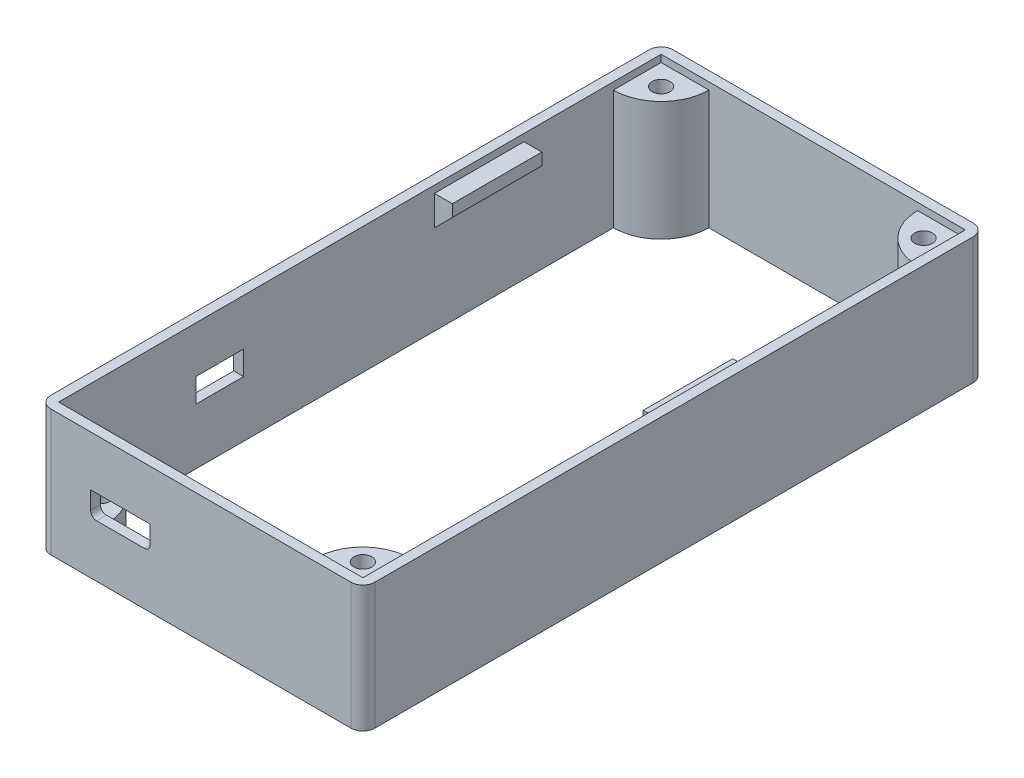
from build123d import *

# Parameters (mm, degrees)
SKICA1_W                 = 54.3
SKICA1_H                 = 104.3
SKICA1_W_2               = 51
SKICA1_H_2               = 101
P_IDAT_VYSUNUT_M1_DEPTH  = 1.2
SKICA2_W                 = 54.3
SKICA2_H                 = 104.3
P_IDAT_VYSUNUT_M2_DEPTH  = 20
SKICA3_R                 = 1.5
ODEBRAT_VYSUNUT_M1_DEPTH = 118.085631057
SKICA5_W                 = 8
SKICA5_H                 = 4
ODEBRAT_VYSUNUT_M2_DEPTH = 2
SKICA6_W                 = 10
SKICA6_H                 = 4
ODEBRAT_VYSUNUT_M3_DEPTH = 5
SKICA9_W                 = 15
SKICA9_H                 = 5
P_IDAT_VYSUNUT_M4_DEPTH  = 2
ZKOSEN_1_SIZE            = 2
SKICA10_W                = 15
SKICA10_H                = 5
P_IDAT_VYSUNUT_M5_DEPTH  = 3
ZKOSEN_2_SIZE            = 3
ZAOBLIT2_R               = 1
ZAOBLIT3_R               = 2
ODEBRAT_VYSUNUT_M5_DEPTH = 12.5
SKICA12_R                = 1.5
ODEBRAT_VYSUNUT_M6_DEPTH = 118.296568577


with BuildPart() as part:
    # Skica1 → Přidat vysunutím1 (new body)
    with BuildSketch(Plane(origin=(0, 0, 0), x_dir=(1, 0, 0), z_dir=(0, 1, 0))):
        with Locations((25.5, 50.5)):
            Rectangle(SKICA1_W, SKICA1_H)
        with Locations((25.5, 50.5)):
            Rectangle(SKICA1_W_2, SKICA1_H_2, mode=Mode.SUBTRACT)
    extrude(amount=P_IDAT_VYSUNUT_M1_DEPTH)

    # Skica2 → Přidat vysunutím2 (add)
    # profile 1 of 5: a face of its own
    with BuildSketch(Plane.XZ):
        with Locations((25.5, -50.5)):
            Rectangle(SKICA2_W, SKICA2_H)
        Polygon((0, -8), (0, 0), (8, 0), (43, 0), (51, 0), (51, -8), (51, -93), (51, -101), (43, -101), (8, -101), (0, -101), (0, -93), align=None, mode=Mode.SUBTRACT)
    # profile 2 of 5: a face of its own
    with BuildSketch(Plane.XZ):
        with BuildLine():
            Line((8, 0), (0, 0))
            Line((0, 0), (0, -8))
            ThreePointArc((0, -8), (5.656854249, -5.656854249), (8, 0))
        make_face()
    # profile 3 of 5: a face of its own
    with BuildSketch(Plane.XZ):
        with BuildLine():
            ThreePointArc((8, -101), (5.656854249, -95.343145751), (0, -93))
            Line((0, -93), (0, -101))
            Line((0, -101), (8, -101))
        make_face()
    # profile 4 of 5: a face of its own
    with BuildSketch(Plane.XZ):
        with BuildLine():
            Line((51, -101), (51, -93))
            ThreePointArc((51, -93), (45.343145751, -95.343145751), (43, -101))
            Line((43, -101), (51, -101))
        make_face()
    # profile 5 of 5: a face of its own
    with BuildSketch(Plane.XZ):
        with BuildLine():
            Line((51, 0), (43, 0))
            ThreePointArc((43, 0), (45.343145751, -5.656854249), (51, -8))
            Line((51, -8), (51, 0))
        make_face()
    extrude(amount=P_IDAT_VYSUNUT_M2_DEPTH)

    # Skica3 → Odebrat vysunutím1 (cut, through all)
    with BuildSketch(Plane(origin=(0, 0, 0), x_dir=(1, 0, 0), z_dir=(0, 1, 0))):
        with Locations(Location((3.5, 97.5, 0), (0, 0, 270))):
            Circle(SKICA3_R)
        with Locations(Location((47.5, 97.5, 0), (0, 0, 270))):
            Circle(SKICA3_R)
        with Locations(Location((47.5, 3.5, 0), (0, 0, 270))):
            Circle(SKICA3_R)
    extrude(amount=-ODEBRAT_VYSUNUT_M1_DEPTH, mode=Mode.SUBTRACT)

    # Skica5 → Odebrat vysunutím2 (cut)
    with BuildSketch(Plane(origin=(0, 0, 0), x_dir=(0, 0, -1), z_dir=(1, 0, 0))):
        with Locations((27, -8.6)):
            Rectangle(SKICA5_W, SKICA5_H)
    extrude(amount=-ODEBRAT_VYSUNUT_M2_DEPTH, mode=Mode.SUBTRACT)

    # Skica6 → Odebrat vysunutím3 (cut, symmetric)
    with BuildSketch(Plane(origin=(0, 0, 0), x_dir=(-1, 0, 0), z_dir=(0, 0, -1))):
        with Locations((-12, -9.2)):
            Rectangle(SKICA6_W, SKICA6_H)
    extrude(amount=ODEBRAT_VYSUNUT_M3_DEPTH, both=True, mode=Mode.SUBTRACT)

    # Skica9 → Přidat vysunutím4 (add)
    with BuildSketch(Plane.ZY.offset(-51)):
        with Locations((-56.5, -2.5)):
            Rectangle(SKICA9_W, SKICA9_H)
    extrude(amount=P_IDAT_VYSUNUT_M4_DEPTH)

    # Zkosení1
    zkosen_1_edges = [part.edges().sort_by_distance(p)[0] for p in [
        (49, -5, -56.5),
    ]]
    chamfer(zkosen_1_edges, length=ZKOSEN_1_SIZE - 0.0001)  # a hair under: the kernel refuses the full size

    # Skica10 → Přidat vysunutím5 (add)
    with BuildSketch(Plane(origin=(0, 0, 0), x_dir=(0, 0, -1), z_dir=(1, 0, 0))):
        with Locations((70.5, -2.5)):
            Rectangle(SKICA10_W, SKICA10_H)
    extrude(amount=P_IDAT_VYSUNUT_M5_DEPTH)

    # Zkosení2
    zkosen_2_edges = [part.edges().sort_by_distance(p)[0] for p in [
        (3, -5, -70.5),
    ]]
    chamfer(zkosen_2_edges, length=ZKOSEN_2_SIZE - 0.0001)  # a hair under: the kernel refuses the full size

    # Zaoblit2
    zaoblit2_edges = [part.edges().sort_by_distance(p)[0] for p in [
        (7, -11.2, -1.111491673),
        (17, -11.2, 0.825),
    ]]
    fillet(zaoblit2_edges, radius=ZAOBLIT2_R)

    # Zaoblit3
    zaoblit3_edges = [part.edges().sort_by_distance(p)[0] for p in [
        (-1.65, -9.4, -102.65),
        (52.65, -9.4, -102.65),
        (52.65, -9.4, 1.65),
        (-1.65, -9.4, 1.65),
    ]]
    fillet(zaoblit3_edges, radius=ZAOBLIT3_R)

    # Skica11 → Odebrat vysunutím5 (cut)
    with BuildSketch(Plane(origin=(0, 0, 0), x_dir=(1, 0, 0), z_dir=(0, 1, 0))):
        with BuildLine():
            Line((0, 8), (0, 0))
            Line((0, 0), (8, 0))
            ThreePointArc((8, 0), (5.656854249, 5.656854249), (0, 8))
        make_face()
    extrude(amount=-ODEBRAT_VYSUNUT_M5_DEPTH, mode=Mode.SUBTRACT)

    # Skica12 → Odebrat vysunutím6 (cut, through all)
    with BuildSketch(Plane.XZ.offset(20)):
        with Locations(Location((3.5, -3.5, 0), (0, 0, 270))):
            Circle(SKICA12_R)
    extrude(amount=-ODEBRAT_VYSUNUT_M6_DEPTH, mode=Mode.SUBTRACT)


solid = part.part
